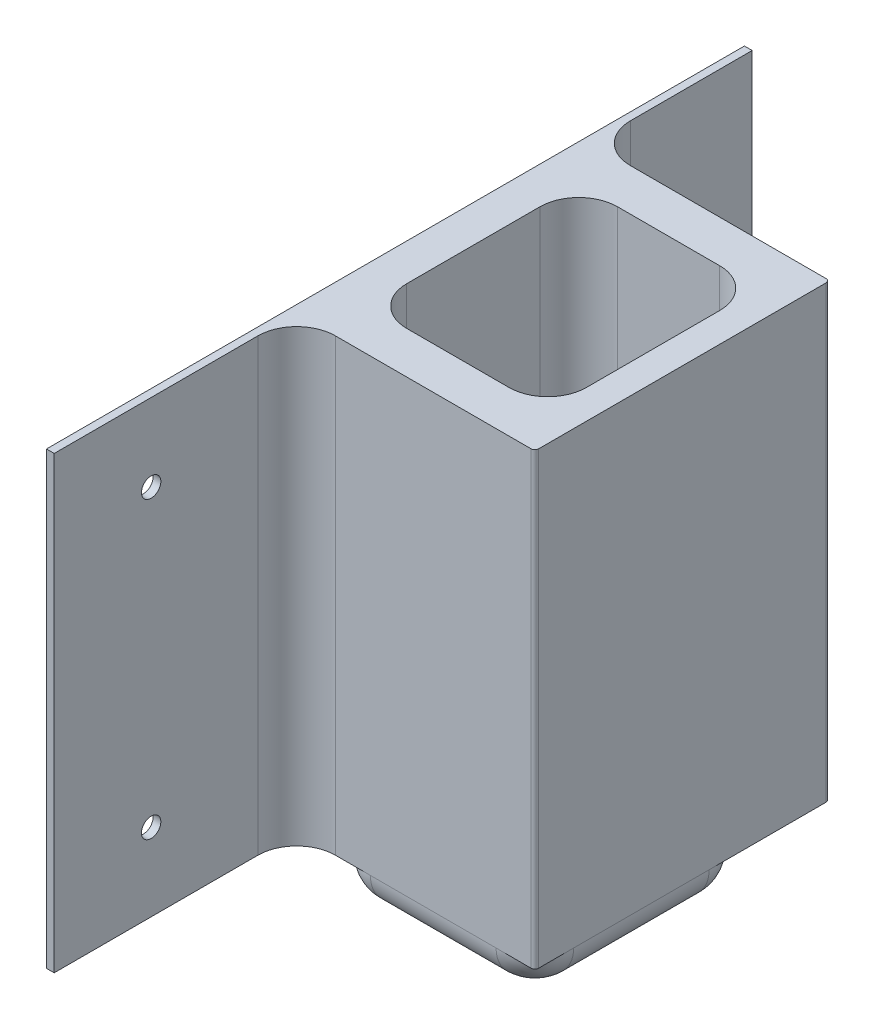
from build123d import *

# Parameters (mm, degrees)
SKETCH1_W                       = 180
SKETCH1_H                       = 116
BOSS_EXTRUDE1_DEPTH             = 2
BOSS_EXTRUDE6_REACH             = 109.089
BOSS_EXTRUDE6_DIRECTION_2_REACH = 109.089
FILLET5_R                       = 10
BOSS_EXTRUDE8_DEPTH             = 8.98
FILLET7_R                       = 8.98
M6X1_0_TAPPED_HOLE1_D           = 5


with BuildPart() as part:
    # Sketch1 → Boss-Extrude1 (new body)
    with BuildSketch(Plane(origin=(0, 0, 0), x_dir=(0, 0, -1), z_dir=(1, 0, 0))):
        Rectangle(SKETCH1_W, SKETCH1_H)
    extrude(amount=BOSS_EXTRUDE1_DEPTH)

    # Boss-Extrude6: up to this face of the body (flat: up to its plane)
    boss_extrude6_end = Plane(part.part.faces().sort_by_distance((1, -58, 0))[0])
    # Sketch9 → Boss-Extrude6 (add, up to the picked face)
    with BuildSketch(Plane(origin=(0, 0, 0), x_dir=(1, 0, 0), z_dir=(0, 1, 0)), mode=Mode.PRIVATE) as boss_extrude6_sk1:
        with BuildLine():
            Line((2, -27.470907931), (20, -27.470907931))
            Line((20, -27.470907931), (62.451993428, -27.470907931))
            ThreePointArc((62.451993428, -27.470907931), (63.142907445, -27.184721975), (63.429093401, -26.493807958))
            Line((63.429093401, -26.493807958), (63.429093401, 47.609249241))
            ThreePointArc((63.429093401, 47.609249241), (63.142907445, 48.300163258), (62.451993428, 48.586349214))
            Line((62.451993428, 48.586349214), (20, 48.586349214))
            Line((20, 48.586349214), (2, 48.586349214))
            Line((2, 48.586349214), (2, 27.673016612))
            Line((2, 27.673016612), (2, -27.470907931))
        make_face()
        with BuildLine():
            Line((45.894546701, -16.622279359), (19.534546701, -16.622279359))
            ThreePointArc((19.534546701, -16.622279359), (12.463478889, -13.693347171), (9.534546701, -6.622279359))
            Line((9.534546701, -6.622279359), (9.534546701, 27.737720641))
            ThreePointArc((9.534546701, 27.737720641), (12.463478889, 34.808788453), (19.534546701, 37.737720641))
            Line((19.534546701, 37.737720641), (45.894546701, 37.737720641))
            ThreePointArc((45.894546701, 37.737720641), (52.965614513, 34.808788453), (55.894546701, 27.737720641))
            Line((55.894546701, 27.737720641), (55.894546701, -6.622279359))
            ThreePointArc((55.894546701, -6.622279359), (52.965614513, -13.693347171), (45.894546701, -16.622279359))
        make_face(mode=Mode.SUBTRACT)
    boss_extrude6_tool1 = split(extrude(boss_extrude6_sk1.sketch, amount=-BOSS_EXTRUDE6_REACH, mode=Mode.PRIVATE), bisect_by=boss_extrude6_end, keep=Keep.BOTH, mode=Mode.PRIVATE)
    add(boss_extrude6_tool1.solids().sort_by(Axis((11, 0, 26.493245), (0, -1, 0)))[0])

    # Boss-Extrude6 direction 2: up to this face of the body (flat: up to its plane)
    boss_extrude6_direction_2_end = Plane(part.part.faces().sort_by_distance((1, 58, 0))[0])
    # Sketch9 → Boss-Extrude6 direction 2 (add, up to the picked face)
    with BuildSketch(Plane(origin=(0, 0, 0), x_dir=(1, 0, 0), z_dir=(0, 1, 0)), mode=Mode.PRIVATE) as boss_extrude6_direction_2_sk1:
        with BuildLine():
            Line((2, -27.470907931), (20, -27.470907931))
            Line((20, -27.470907931), (62.451993428, -27.470907931))
            ThreePointArc((62.451993428, -27.470907931), (63.142907445, -27.184721975), (63.429093401, -26.493807958))
            Line((63.429093401, -26.493807958), (63.429093401, 47.609249241))
            ThreePointArc((63.429093401, 47.609249241), (63.142907445, 48.300163258), (62.451993428, 48.586349214))
            Line((62.451993428, 48.586349214), (20, 48.586349214))
            Line((20, 48.586349214), (2, 48.586349214))
            Line((2, 48.586349214), (2, 27.673016612))
            Line((2, 27.673016612), (2, -27.470907931))
        make_face()
        with BuildLine():
            Line((45.894546701, -16.622279359), (19.534546701, -16.622279359))
            ThreePointArc((19.534546701, -16.622279359), (12.463478889, -13.693347171), (9.534546701, -6.622279359))
            Line((9.534546701, -6.622279359), (9.534546701, 27.737720641))
            ThreePointArc((9.534546701, 27.737720641), (12.463478889, 34.808788453), (19.534546701, 37.737720641))
            Line((19.534546701, 37.737720641), (45.894546701, 37.737720641))
            ThreePointArc((45.894546701, 37.737720641), (52.965614513, 34.808788453), (55.894546701, 27.737720641))
            Line((55.894546701, 27.737720641), (55.894546701, -6.622279359))
            ThreePointArc((55.894546701, -6.622279359), (52.965614513, -13.693347171), (45.894546701, -16.622279359))
        make_face(mode=Mode.SUBTRACT)
    boss_extrude6_direction_2_tool1 = split(extrude(boss_extrude6_direction_2_sk1.sketch, amount=BOSS_EXTRUDE6_DIRECTION_2_REACH, mode=Mode.PRIVATE), bisect_by=boss_extrude6_direction_2_end, keep=Keep.BOTH, mode=Mode.PRIVATE)
    add(boss_extrude6_direction_2_tool1.solids().sort_by(Axis((11, 0, 26.493245), (0, 1, 0)))[0])

    # Fillet5
    fillet5_edges = [part.edges().sort_by_distance(p)[0] for p in [
        (2, 0, 27.470907931),
        (2, 0, -48.586349214),
    ]]
    fillet(fillet5_edges, radius=FILLET5_R)

    # Sketch11 → Boss-Extrude8 (add)
    with BuildSketch(Plane.XZ.offset(58)):
        with BuildLine():
            Line((21.022900027, -27.470907931), (53.429093401, -27.470907931))
            ThreePointArc((53.429093401, -27.470907931), (60.500161213, -24.541975743), (63.429093401, -17.470907931))
            Line((63.429093401, -17.470907931), (63.429093401, 17.470907931))
            ThreePointArc((63.429093401, 17.470907931), (60.500161213, 24.541975743), (53.429093401, 27.470907931))
            Line((53.429093401, 27.470907931), (21.022900027, 27.470907931))
            ThreePointArc((21.022900027, 27.470907931), (13.951832215, 24.541975743), (11.022900027, 17.470907931))
            Line((11.022900027, 17.470907931), (11.022900027, -17.470907931))
            ThreePointArc((11.022900027, -17.470907931), (13.951832215, -24.541975743), (21.022900027, -27.470907931))
        make_face()
    extrude(amount=BOSS_EXTRUDE8_DEPTH)

    # Fillet7
    fillet7_edges = [part.edges().sort_by_distance(p)[0] for p in [
        (60.500161213, -66.98, -24.541975743),
        (37.225996714, -66.98, -27.470907931),
        (13.951832215, -66.98, -24.541975743),
        (11.022900027, -66.98, 0),
        (13.951832215, -66.98, 24.541975743),
        (63.429093401, -66.98, 0),
        (60.500161213, -66.98, 24.541975743),
        (37.225996714, -66.98, 27.470907931),
    ]]
    fillet(fillet7_edges, radius=FILLET7_R - 0.0001)  # a hair under: the kernel refuses the full size

    # M6x1.0 Tapped Hole1 (through all)
    with Locations(Plane(origin=(2, 0, 0), x_dir=(0, 0, -1), z_dir=(1, 0, 0))):
        with Locations((-65, 38), (-65, -38), (65, -38), (65, 38)):
            Hole(M6X1_0_TAPPED_HOLE1_D / 2)


solid = part.part
